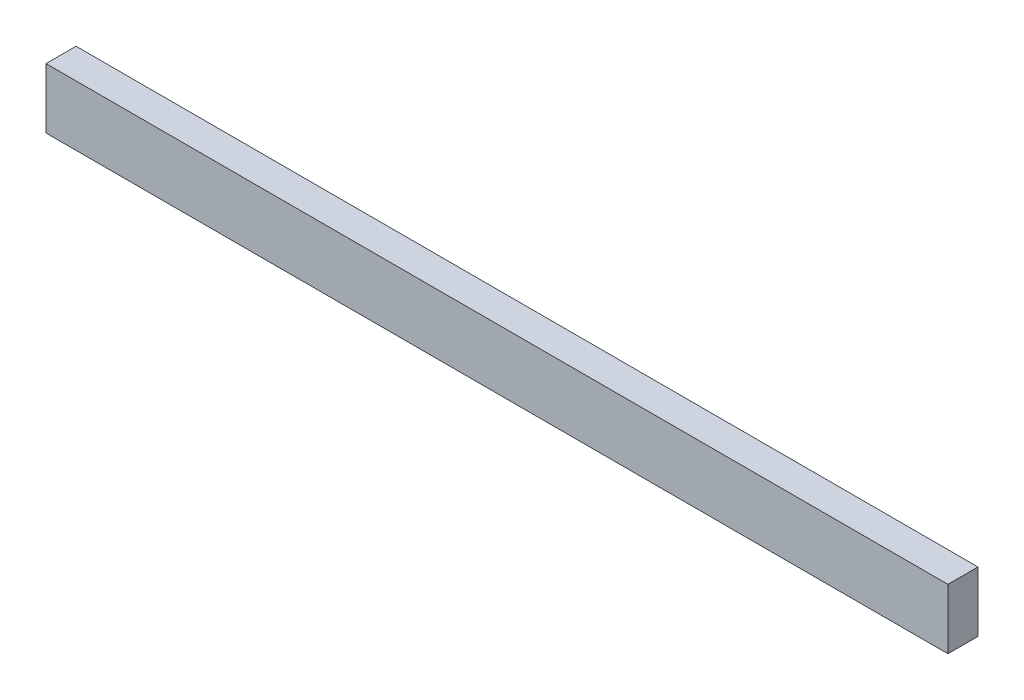
from build123d import *

# Parameters (mm, degrees)
SKETCH1_W           = 3000
SKETCH1_H           = 200
BOSS_EXTRUDE1_DEPTH = 100


with BuildPart() as part:
    # Sketch1 → Boss-Extrude1 (new body)
    with BuildSketch(Plane.XY):
        with Locations((1500, -100)):
            Rectangle(SKETCH1_W, SKETCH1_H)
    extrude(amount=BOSS_EXTRUDE1_DEPTH)


solid = part.part
